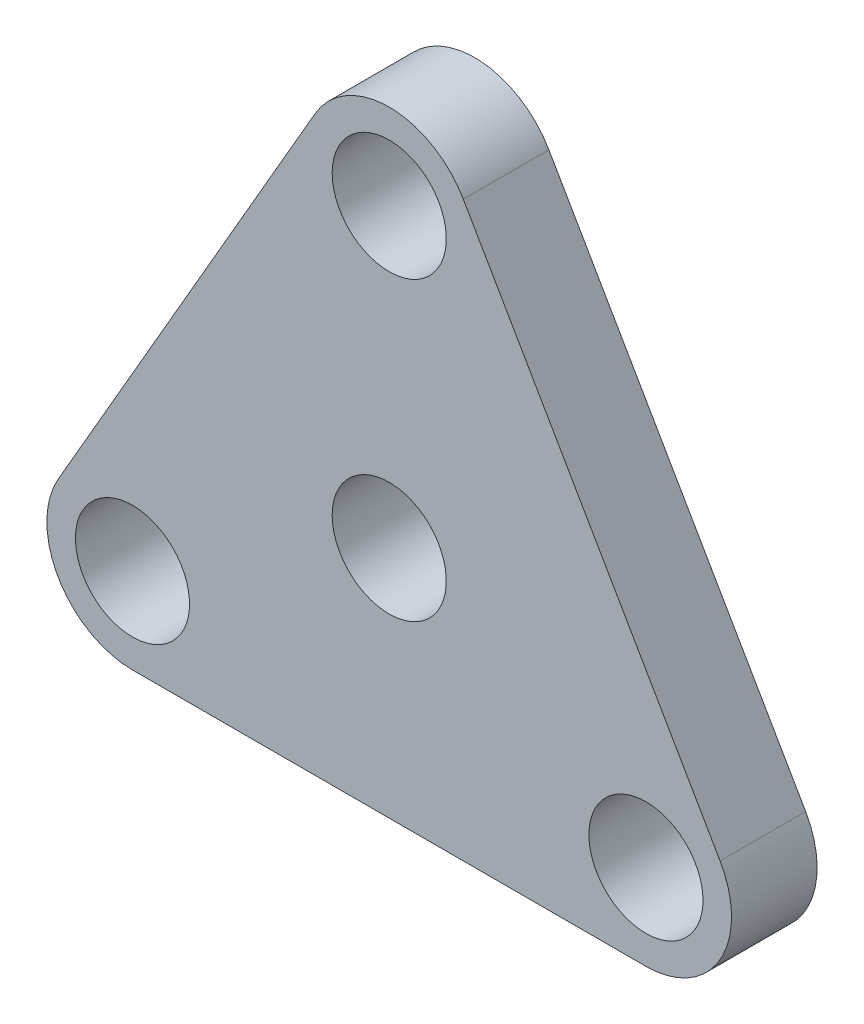
from build123d import *

# Parameters (mm, degrees)
SKETCH1_R           = 6.35
BOSS_EXTRUDE1_DEPTH = 9.525


with BuildPart() as part:
    # Sketch1 → Boss-Extrude1 (new body)
    with BuildSketch(Plane.XY):
        with BuildLine():
            Line((-8.248891971, 37.758067884), (-36.823891971, -11.735283942))
            ThreePointArc((-36.823891971, -11.735283942), (-36.823891971, -21.260283942), (-28.575, -26.022783942))
            Line((-28.575, -26.022783942), (28.575, -26.022783942))
            ThreePointArc((28.575, -26.022783942), (36.823891971, -21.260283942), (36.823891971, -11.735283942))
            Line((36.823891971, -11.735283942), (8.248891971, 37.758067884))
            ThreePointArc((8.248891971, 37.758067884), (0, 42.520567884), (-8.248891971, 37.758067884))
        make_face()
        Circle(SKETCH1_R, mode=Mode.SUBTRACT)
        with Locations((-28.575, -16.497783942)):
            Circle(SKETCH1_R, mode=Mode.SUBTRACT)
        with Locations((0, 32.995567884)):
            Circle(SKETCH1_R, mode=Mode.SUBTRACT)
        with Locations((28.575, -16.497783942)):
            Circle(SKETCH1_R, mode=Mode.SUBTRACT)
    extrude(amount=BOSS_EXTRUDE1_DEPTH)


solid = part.part
